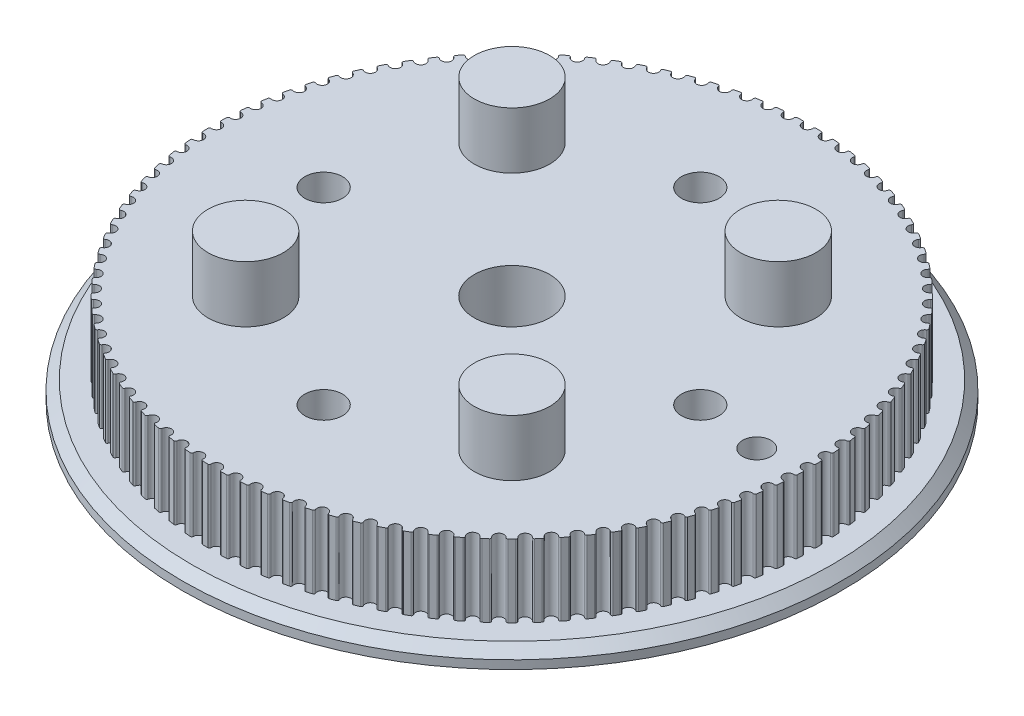
from build123d import *

# Parameters (mm, degrees)
SKETCH1_R                = 31.6
SKETCH1_R_2              = 4
BOSS_EXTRUDE1_DEPTH      = 7.7
SKETCH2_R                = 0.55
CUT_EXTRUDE2_DEPTH       = 7.7
FILLET2_R                = 0.16
CIRPATTERN1_COUNT        = 100
FILLET2_OF_CIRPATTERN1_R = 0.16
BOSS_EXTRUDE2_START      = 1.9
SKETCH3_R                = 35
SKETCH3_R_2              = 4
BOSS_EXTRUDE2_DEPTH      = 1.9
SKETCH4_R                = 2
CUT_EXTRUDE3_DEPTH       = 51.419837524
SKETCH5_R                = 3.7
CUT_EXTRUDE4_DEPTH       = 4
CHAMFER1_SIZE            = 1
SKETCH6_R                = 4
BOSS_EXTRUDE3_DEPTH      = 6
SKETCH7_R                = 1.5
CUT_EXTRUDE5_DEPTH       = 52.897591466


with BuildPart() as part:
    # Sketch1 → Boss-Extrude1 (new body)
    with BuildSketch(Plane(origin=(0, 0, 0), x_dir=(1, 0, 0), z_dir=(0, 1, 0))):
        Circle(SKETCH1_R)
        Circle(SKETCH1_R_2, mode=Mode.SUBTRACT)
    extrude(amount=BOSS_EXTRUDE1_DEPTH)

    # Sketch2 → Cut-Extrude2 (cut)
    with BuildSketch(Plane.XZ):
        with Locations((0, 31.39)):
            Circle(SKETCH2_R)
    cut_extrude2 = extrude(amount=-CUT_EXTRUDE2_DEPTH, mode=Mode.SUBTRACT)

    # Fillet2
    fillet2_edges = [part.edges().sort_by_distance(p)[0] for p in [
        (0.510011532, 3.85, 31.59588404),
        (-0.510011532, 3.85, 31.59588404),
    ]]
    fillet(fillet2_edges, radius=FILLET2_R)

    # CirPattern1: Cut-Extrude2 ×100 about axis
    cirpattern1_axis = Axis((0, 0, 0), (0, 1, 0))
    for i in range(1, CIRPATTERN1_COUNT):
        add(cut_extrude2.rotate(cirpattern1_axis, i * 360 / CIRPATTERN1_COUNT), mode=Mode.SUBTRACT)

    # Fillet2 of CirPattern1
    fillet2_of_cirpattern1_edges = [part.edges().sort_by_distance(p)[0] for p in [
        (2.492927114, 3.85, 31.501512891),
        (1.474916834, 3.85, 31.565560669),
        (4.466004252, 3.85, 31.282819662),
        (3.454024376, 3.85, 31.410662451),
        (6.421456112, 3.85, 30.940667436),
        (5.419500462, 3.85, 31.131800699),
        (8.351565418, 3.85, 30.476406531),
        (7.363588255, 3.85, 30.730075952),
        (10.248714911, 3.85, 29.891869173),
        (9.27861533, 3.85, 30.207073634),
        (12.105417408, 3.85, 29.189362264),
        (11.157023949, 3.85, 29.564857798),
        (13.914345353, 3.85, 28.371658277),
        (12.991400892, 3.85, 28.805962974),
        (15.668359734, 3.85, 27.441984317),
        (14.774506711, 3.85, 27.933384175),
        (17.360538258, 3.85, 26.404009381),
        (16.499304301, 3.85, 26.95056507),
        (18.984202668, 3.85, 25.261829884),
        (18.158986675, 3.85, 25.861384397),
        (20.532945103, 3.85, 24.019953484),
        (19.747003825, 3.85, 24.670140655),
        (22.000653385, 3.85, 22.683281303),
        (21.257088572, 3.85, 23.381535138),
        (23.381535138, 3.85, 21.257088572),
        (22.683281303, 3.85, 22.000653385),
        (24.670140655, 3.85, 19.747003825),
        (24.019953484, 3.85, 20.532945103),
        (25.861384397, 3.85, 18.158986675),
        (25.261829884, 3.85, 18.984202668),
        (26.95056507, 3.85, 16.499304301),
        (26.404009381, 3.85, 17.360538258),
        (27.933384175, 3.85, 14.774506711),
        (27.441984317, 3.85, 15.668359734),
        (28.805962974, 3.85, 12.991400892),
        (28.371658277, 3.85, 13.914345353),
        (29.564857798, 3.85, 11.157023949),
        (29.189362264, 3.85, 12.105417408),
        (30.207073634, 3.85, 9.27861533),
        (29.891869173, 3.85, 10.248714911),
        (30.730075952, 3.85, 7.363588255),
        (30.476406531, 3.85, 8.351565418),
        (31.131800699, 3.85, 5.419500462),
        (30.940667436, 3.85, 6.421456112),
        (31.410662451, 3.85, 3.454024376),
        (31.282819662, 3.85, 4.466004252),
        (31.565560669, 3.85, 1.474916834),
        (31.501512891, 3.85, 2.492927114),
        (31.59588404, 3.85, -0.510011532),
        (31.59588404, 3.85, 0.510011532),
        (31.501512891, 3.85, -2.492927114),
        (31.565560669, 3.85, -1.474916834),
        (31.282819662, 3.85, -4.466004252),
        (31.410662451, 3.85, -3.454024376),
        (30.940667436, 3.85, -6.421456112),
        (31.131800699, 3.85, -5.419500462),
        (30.476406531, 3.85, -8.351565418),
        (30.730075952, 3.85, -7.363588255),
        (29.891869173, 3.85, -10.248714911),
        (30.207073634, 3.85, -9.27861533),
        (29.189362264, 3.85, -12.105417408),
        (29.564857798, 3.85, -11.157023949),
        (28.371658277, 3.85, -13.914345353),
        (28.805962974, 3.85, -12.991400892),
        (27.441984317, 3.85, -15.668359734),
        (27.933384175, 3.85, -14.774506711),
        (26.404009381, 3.85, -17.360538258),
        (26.95056507, 3.85, -16.499304301),
        (25.261829884, 3.85, -18.984202668),
        (25.861384397, 3.85, -18.158986675),
        (24.019953484, 3.85, -20.532945103),
        (24.670140655, 3.85, -19.747003825),
        (22.683281303, 3.85, -22.000653385),
        (23.381535138, 3.85, -21.257088572),
        (21.257088572, 3.85, -23.381535138),
        (22.000653385, 3.85, -22.683281303),
        (19.747003825, 3.85, -24.670140655),
        (20.532945103, 3.85, -24.019953484),
        (18.158986675, 3.85, -25.861384397),
        (18.984202668, 3.85, -25.261829884),
        (16.499304301, 3.85, -26.95056507),
        (17.360538258, 3.85, -26.404009381),
        (14.774506711, 3.85, -27.933384175),
        (15.668359734, 3.85, -27.441984317),
        (12.991400892, 3.85, -28.805962974),
        (13.914345353, 3.85, -28.371658277),
        (11.157023949, 3.85, -29.564857798),
        (12.105417408, 3.85, -29.189362264),
        (9.27861533, 3.85, -30.207073634),
        (10.248714911, 3.85, -29.891869173),
        (7.363588255, 3.85, -30.730075952),
        (8.351565418, 3.85, -30.476406531),
        (5.419500462, 3.85, -31.131800699),
        (6.421456112, 3.85, -30.940667436),
        (3.454024376, 3.85, -31.410662451),
        (4.466004252, 3.85, -31.282819662),
        (1.474916834, 3.85, -31.565560669),
        (2.492927114, 3.85, -31.501512891),
        (-0.510011532, 3.85, -31.59588404),
        (0.510011532, 3.85, -31.59588404),
        (-2.492927114, 3.85, -31.501512891),
        (-1.474916834, 3.85, -31.565560669),
        (-4.466004252, 3.85, -31.282819662),
        (-3.454024376, 3.85, -31.410662451),
        (-6.421456112, 3.85, -30.940667436),
        (-5.419500462, 3.85, -31.131800699),
        (-8.351565418, 3.85, -30.476406531),
        (-7.363588255, 3.85, -30.730075952),
        (-10.248714911, 3.85, -29.891869173),
        (-9.27861533, 3.85, -30.207073634),
        (-12.105417408, 3.85, -29.189362264),
        (-11.157023949, 3.85, -29.564857798),
        (-13.914345353, 3.85, -28.371658277),
        (-12.991400892, 3.85, -28.805962974),
        (-15.668359734, 3.85, -27.441984317),
        (-14.774506711, 3.85, -27.933384175),
        (-17.360538258, 3.85, -26.404009381),
        (-16.499304301, 3.85, -26.95056507),
        (-18.984202668, 3.85, -25.261829884),
        (-18.158986675, 3.85, -25.861384397),
        (-20.532945103, 3.85, -24.019953484),
        (-19.747003825, 3.85, -24.670140655),
        (-22.000653385, 3.85, -22.683281303),
        (-21.257088572, 3.85, -23.381535138),
        (-23.381535138, 3.85, -21.257088572),
        (-22.683281303, 3.85, -22.000653385),
        (-24.670140655, 3.85, -19.747003825),
        (-24.019953484, 3.85, -20.532945103),
        (-25.861384397, 3.85, -18.158986675),
        (-25.261829884, 3.85, -18.984202668),
        (-26.95056507, 3.85, -16.499304301),
        (-26.404009381, 3.85, -17.360538258),
        (-27.933384175, 3.85, -14.774506711),
        (-27.441984317, 3.85, -15.668359734),
        (-28.805962974, 3.85, -12.991400892),
        (-28.371658277, 3.85, -13.914345353),
        (-29.564857798, 3.85, -11.157023949),
        (-29.189362264, 3.85, -12.105417408),
        (-30.207073634, 3.85, -9.27861533),
        (-29.891869173, 3.85, -10.248714911),
        (-30.730075952, 3.85, -7.363588255),
        (-30.476406531, 3.85, -8.351565418),
        (-31.131800699, 3.85, -5.419500462),
        (-30.940667436, 3.85, -6.421456112),
        (-31.410662451, 3.85, -3.454024376),
        (-31.282819662, 3.85, -4.466004252),
        (-31.565560669, 3.85, -1.474916834),
        (-31.501512891, 3.85, -2.492927114),
        (-31.59588404, 3.85, 0.510011532),
        (-31.59588404, 3.85, -0.510011532),
        (-31.501512891, 3.85, 2.492927114),
        (-31.565560669, 3.85, 1.474916834),
        (-31.282819662, 3.85, 4.466004252),
        (-31.410662451, 3.85, 3.454024376),
        (-30.940667436, 3.85, 6.421456112),
        (-31.131800699, 3.85, 5.419500462),
        (-30.476406531, 3.85, 8.351565418),
        (-30.730075952, 3.85, 7.363588255),
        (-29.891869173, 3.85, 10.248714911),
        (-30.207073634, 3.85, 9.27861533),
        (-29.189362264, 3.85, 12.105417408),
        (-29.564857798, 3.85, 11.157023949),
        (-28.371658277, 3.85, 13.914345353),
        (-28.805962974, 3.85, 12.991400892),
        (-27.441984317, 3.85, 15.668359734),
        (-27.933384175, 3.85, 14.774506711),
        (-26.404009381, 3.85, 17.360538258),
        (-26.95056507, 3.85, 16.499304301),
        (-25.261829884, 3.85, 18.984202668),
        (-25.861384397, 3.85, 18.158986675),
        (-24.019953484, 3.85, 20.532945103),
        (-24.670140655, 3.85, 19.747003825),
        (-22.683281303, 3.85, 22.000653385),
        (-23.381535138, 3.85, 21.257088572),
        (-21.257088572, 3.85, 23.381535138),
        (-22.000653385, 3.85, 22.683281303),
        (-19.747003825, 3.85, 24.670140655),
        (-20.532945103, 3.85, 24.019953484),
        (-18.158986675, 3.85, 25.861384397),
        (-18.984202668, 3.85, 25.261829884),
        (-16.499304301, 3.85, 26.95056507),
        (-17.360538258, 3.85, 26.404009381),
        (-14.774506711, 3.85, 27.933384175),
        (-15.668359734, 3.85, 27.441984317),
        (-12.991400892, 3.85, 28.805962974),
        (-13.914345353, 3.85, 28.371658277),
        (-11.157023949, 3.85, 29.564857798),
        (-12.105417408, 3.85, 29.189362264),
        (-9.27861533, 3.85, 30.207073634),
        (-10.248714911, 3.85, 29.891869173),
        (-7.363588255, 3.85, 30.730075952),
        (-8.351565418, 3.85, 30.476406531),
        (-5.419500462, 3.85, 31.131800699),
        (-6.421456112, 3.85, 30.940667436),
        (-3.454024376, 3.85, 31.410662451),
        (-4.466004252, 3.85, 31.282819662),
        (-1.474916834, 3.85, 31.565560669),
        (-2.492927114, 3.85, 31.501512891),
    ]]
    fillet(fillet2_of_cirpattern1_edges, radius=FILLET2_OF_CIRPATTERN1_R)

    # Sketch3 → Boss-Extrude2 (add)
    with BuildSketch(Plane.XZ.offset(BOSS_EXTRUDE2_START)):
        Circle(SKETCH3_R)
        Circle(SKETCH3_R_2, mode=Mode.SUBTRACT)
    extrude(amount=-BOSS_EXTRUDE2_DEPTH)

    # Sketch4 → Cut-Extrude3 (cut, through all)
    with BuildSketch(Plane.XZ.offset(1.9)):
        with Locations((0, 20)):
            Circle(SKETCH4_R)
        with Locations((20, 0)):
            Circle(SKETCH4_R)
        with Locations((0, -20)):
            Circle(SKETCH4_R)
        with Locations((-20, 0)):
            Circle(SKETCH4_R)
    extrude(amount=-CUT_EXTRUDE3_DEPTH, mode=Mode.SUBTRACT)

    # Sketch5 → Cut-Extrude4 (cut)
    with BuildSketch(Plane.XZ.offset(1.9)):
        with Locations((0, 20)):
            Circle(SKETCH5_R)
        with Locations((20, 0)):
            Circle(SKETCH5_R)
        with Locations((0, -20)):
            Circle(SKETCH5_R)
        with Locations((-20, 0)):
            Circle(SKETCH5_R)
    extrude(amount=-CUT_EXTRUDE4_DEPTH, mode=Mode.SUBTRACT)

    # Chamfer1
    chamfer1_edges = [part.edges().sort_by_distance(p)[0] for p in [
        (-35, 0, 0),
    ]]
    chamfer(chamfer1_edges, length=CHAMFER1_SIZE)

    # Sketch6 → Boss-Extrude3 (add)
    with BuildSketch(Plane(origin=(0, 7.7, 0), x_dir=(1, 0, 0), z_dir=(0, 1, 0))):
        with Locations((14.142135624, 14.142135624)):
            Circle(SKETCH6_R)
        with Locations((14.142135624, -14.142135624)):
            Circle(SKETCH6_R)
        with Locations((-14.142135624, -14.142135624)):
            Circle(SKETCH6_R)
        with Locations((-14.142135624, 14.142135624)):
            Circle(SKETCH6_R)
    extrude(amount=BOSS_EXTRUDE3_DEPTH)

    # Sketch7 → Cut-Extrude5 (cut, through all)
    with BuildSketch(Plane.XZ.offset(1.9)):
        with Locations((27, 1)):
            Circle(SKETCH7_R)
    extrude(amount=-CUT_EXTRUDE5_DEPTH, mode=Mode.SUBTRACT)


solid = part.part
